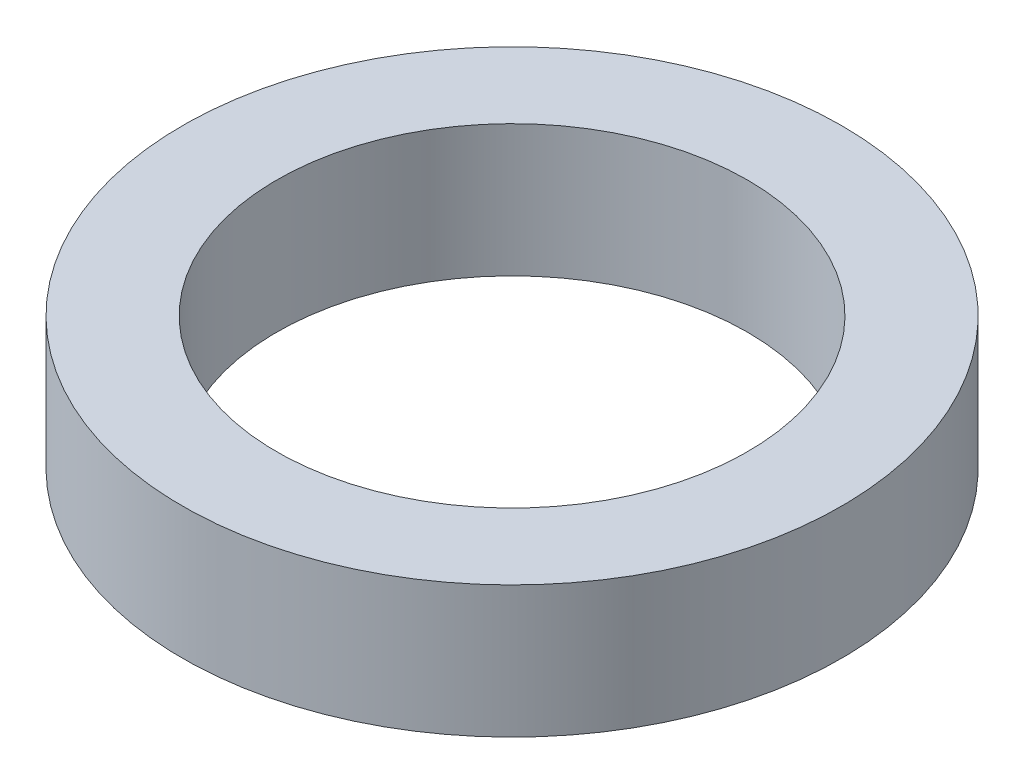
from build123d import *

# Parameters (mm, degrees)
SKETCH1_W = 4.999999652
SKETCH1_H = 7


with BuildPart() as part:
    # Sketch1 → Revolve1 (revolve)
    with BuildSketch(Plane(origin=(0, 0, 0), x_dir=(0, 0, -1), z_dir=(1, 0, 0))):
        with Locations((-15.000000226, 3.5)):
            Rectangle(SKETCH1_W, SKETCH1_H)
    revolve(axis=Axis((0, -36.563986372, 0), (0, 1, 0)))


solid = part.part
